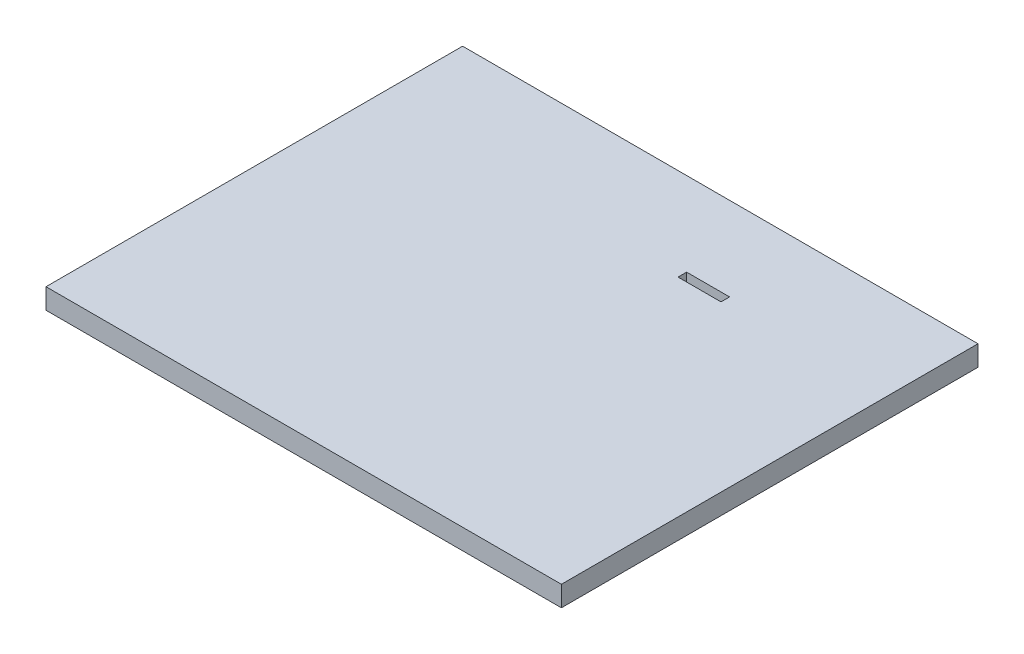
from build123d import *

# Parameters (mm, degrees)
SKETCH_1_W          = 240
SKETCH_1_H          = 194
EXTRUDE_1_DEPTH     = 9.5
SKETCH_3_W          = 20
SKETCH_3_H          = 4
CUT_EXTRUDE_1_DEPTH = 309.749493927


with BuildPart() as part:
    # 草图1 → 凸台-拉伸1 (new body)
    with BuildSketch(Plane(origin=(0, 0, 0), x_dir=(1, 0, 0), z_dir=(0, 1, 0))):
        with Locations((120, -97)):
            Rectangle(SKETCH_1_W, SKETCH_1_H)
    extrude(amount=EXTRUDE_1_DEPTH)

    # 草图3 → 切除-拉伸1 (cut, through all)
    with BuildSketch(Plane(origin=(0, 9.5, 0), x_dir=(1, 0, 0), z_dir=(0, 1, 0))):
        with Locations((153.281521344, -40.959141536)):
            Rectangle(SKETCH_3_W, SKETCH_3_H)
    extrude(amount=-CUT_EXTRUDE_1_DEPTH, mode=Mode.SUBTRACT)


solid = part.part
